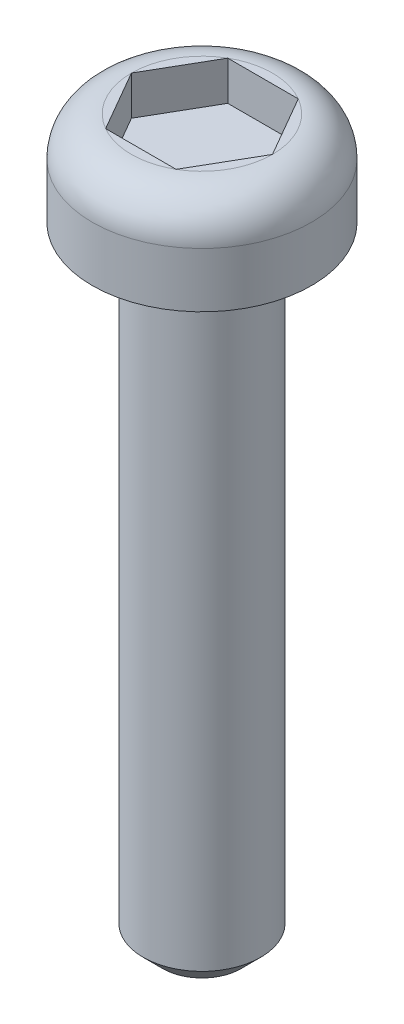
from build123d import *

# Parameters (mm, degrees)
SKETCH1_R           = 1.5
BOSS_EXTRUDE1_DEPTH = 16
SKETCH2_R           = 2.8
BOSS_EXTRUDE2_DEPTH = 2.4
FILLET1_R           = 1
CUT_EXTRUDE1_DEPTH  = 1
CHAMFER1_SIZE       = 0.5


with BuildPart() as part:
    # Sketch1 → Boss-Extrude1 (new body)
    with BuildSketch(Plane(origin=(0, 0, 0), x_dir=(1, 0, 0), z_dir=(0, 1, 0))):
        Circle(SKETCH1_R)
    extrude(amount=BOSS_EXTRUDE1_DEPTH)

    # Sketch2 → Boss-Extrude2 (add)
    with BuildSketch(Plane(origin=(0, 16, 0), x_dir=(1, 0, 0), z_dir=(0, 1, 0))):
        Circle(SKETCH2_R)
    extrude(amount=BOSS_EXTRUDE2_DEPTH)

    # Fillet1
    fillet1_edges = [part.edges().sort_by_distance(p)[0] for p in [
        (-2.8, 18.4, 0),
    ]]
    fillet(fillet1_edges, radius=FILLET1_R)

    # Sketch3 → Cut-Extrude1 (cut)
    with BuildSketch(Plane(origin=(0, 18.4, 0), x_dir=(1, 0, 0), z_dir=(0, 1, 0))):
        Polygon((1.8, 0), (0.9, 1.558845727), (-0.9, 1.558845727), (-1.8, 0), (-0.9, -1.558845727), (0.9, -1.558845727), align=None)
    extrude(amount=-CUT_EXTRUDE1_DEPTH, mode=Mode.SUBTRACT)

    # Chamfer1
    chamfer1_edges = [part.edges().sort_by_distance(p)[0] for p in [
        (-1.5, 0, 0),
    ]]
    chamfer(chamfer1_edges, length=CHAMFER1_SIZE)


solid = part.part
